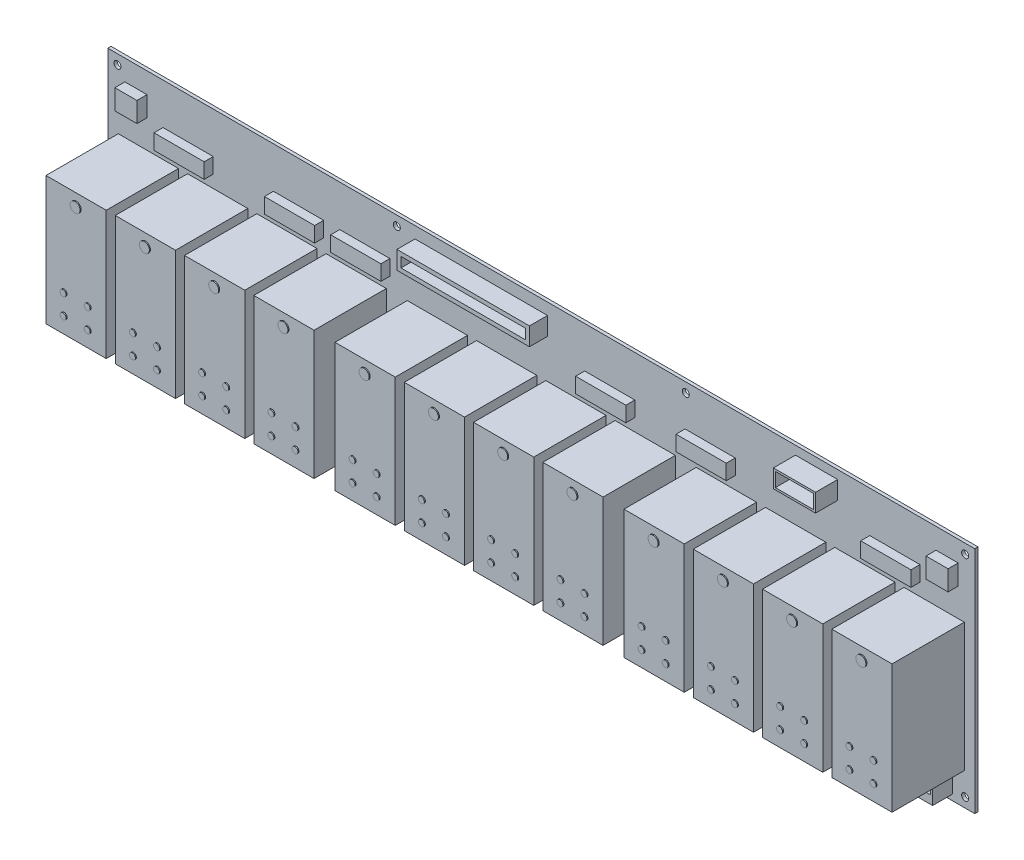
from build123d import *

# Parameters (mm, degrees)
SKETCH1_W    = 431.8
SKETCH1_H    = 114.3
PCB_DEPTH    = 1.6
SKETCH2_W    = 25
SKETCH2_H    = 7.6
BODY00_DEPTH = 4.5
SKETCH3_W    = 11
SKETCH3_H    = 10
BODY01_DEPTH = 5
SKETCH4_W    = 66
SKETCH4_H    = 9
BODY02_DEPTH = 9
SKETCH5_W    = 121.92
SKETCH5_H    = 9
BODY03_DEPTH = 10
SKETCH6_W    = 21
SKETCH6_H    = 9
BODY04_DEPTH = 11
SKETCH7_W    = 30
SKETCH7_H    = 64
BODY05_DEPTH = 36
SKETCH8_R    = 1.5
SKETCH8_R_2  = 2.5
BODY06_DEPTH = 0.5
SKETCH9_W    = 3.2
SKETCH9_H    = 3.2
CUT00_DEPTH  = 4
SKETCH10_W   = 62
SKETCH10_H   = 5
CUT01_DEPTH  = 7
SKETCH11_W   = 2.8
SKETCH11_H   = 2.8
CUT02_DEPTH  = 3
SKETCH12_W   = 19
SKETCH12_H   = 7
CUT03_DEPTH  = 8
SKETCH13_R   = 1.75
HOLES_DEPTH  = 1.6


with BuildPart() as part:
    # Sketch1 → PCB (new body)
    with BuildSketch(Plane.XY):
        with Locations((215.9, 57.15)):
            Rectangle(SKETCH1_W, SKETCH1_H)
    extrude(amount=PCB_DEPTH)

    # Sketch2 → Body00 (add)
    with BuildSketch(Plane.XY.offset(1.6)):
        with Locations((40, 90)):
            Rectangle(SKETCH2_W, SKETCH2_H)
        with Locations((95, 90)):
            Rectangle(SKETCH2_W, SKETCH2_H)
        with Locations((128, 90)):
            Rectangle(SKETCH2_W, SKETCH2_H)
        with Locations((250, 90)):
            Rectangle(SKETCH2_W, SKETCH2_H)
        with Locations((300, 90)):
            Rectangle(SKETCH2_W, SKETCH2_H)
        with Locations((392, 90)):
            Rectangle(SKETCH2_W, SKETCH2_H)
    extrude(amount=BODY00_DEPTH)

    # Sketch3 → Body01 (add)
    with BuildSketch(Plane.XY.offset(1.6)):
        with Locations((14, 99)):
            Rectangle(SKETCH3_W, SKETCH3_H)
        with Locations((418, 99)):
            Rectangle(SKETCH3_W, SKETCH3_H)
    extrude(amount=BODY01_DEPTH)

    # Sketch4 → Body02 (add)
    with BuildSketch(Plane.XY.offset(1.6)):
        with Locations((186, 104)):
            Rectangle(SKETCH4_W, SKETCH4_H)
    extrude(amount=BODY02_DEPTH)

    # Sketch5 → Body03 (add)
    with BuildSketch(Plane.XY.offset(1.6)):
        with Locations((71.967, 7.5)):
            Rectangle(SKETCH5_W, SKETCH5_H)
        with Locations((215.9, 7.5)):
            Rectangle(SKETCH5_W, SKETCH5_H)
        with Locations((359.833, 7.5)):
            Rectangle(SKETCH5_W, SKETCH5_H)
    extrude(amount=BODY03_DEPTH)

    # Sketch6 → Body04 (add)
    with BuildSketch(Plane.XY.offset(1.6)):
        with Locations((353, 105.5)):
            Rectangle(SKETCH6_W, SKETCH6_H)
    extrude(amount=BODY04_DEPTH)

    # Sketch7 → Body05 (add)
    with BuildSketch(Plane.XY.offset(1.6)):
        with Locations((20.217, 48)):
            Rectangle(SKETCH7_W, SKETCH7_H)
        with Locations((54.717, 48)):
            Rectangle(SKETCH7_W, SKETCH7_H)
        with Locations((89.217, 48)):
            Rectangle(SKETCH7_W, SKETCH7_H)
        with Locations((123.717, 48)):
            Rectangle(SKETCH7_W, SKETCH7_H)
        with Locations((164.15, 48)):
            Rectangle(SKETCH7_W, SKETCH7_H)
        with Locations((198.65, 48)):
            Rectangle(SKETCH7_W, SKETCH7_H)
        with Locations((233.15, 48)):
            Rectangle(SKETCH7_W, SKETCH7_H)
        with Locations((267.65, 48)):
            Rectangle(SKETCH7_W, SKETCH7_H)
        with Locations((308.083, 48)):
            Rectangle(SKETCH7_W, SKETCH7_H)
        with Locations((342.583, 48)):
            Rectangle(SKETCH7_W, SKETCH7_H)
        with Locations((377.083, 48)):
            Rectangle(SKETCH7_W, SKETCH7_H)
        with Locations((411.583, 48)):
            Rectangle(SKETCH7_W, SKETCH7_H)
    extrude(amount=BODY05_DEPTH)

    # Sketch8 → Body06 (add)
    with BuildSketch(Plane.XY.offset(37.6)):
        with Locations((14.217, 24)):
            Circle(SKETCH8_R)
        with Locations((14.217, 34)):
            Circle(SKETCH8_R)
        with Locations((26.217, 24)):
            Circle(SKETCH8_R)
        with Locations((26.217, 34)):
            Circle(SKETCH8_R)
        with Locations((20.217, 74)):
            Circle(SKETCH8_R_2)
        with Locations((48.717, 24)):
            Circle(SKETCH8_R)
        with Locations((48.717, 34)):
            Circle(SKETCH8_R)
        with Locations((60.717, 24)):
            Circle(SKETCH8_R)
        with Locations((60.717, 34)):
            Circle(SKETCH8_R)
        with Locations((54.717, 74)):
            Circle(SKETCH8_R_2)
        with Locations((83.217, 24)):
            Circle(SKETCH8_R)
        with Locations((83.217, 34)):
            Circle(SKETCH8_R)
        with Locations((95.217, 24)):
            Circle(SKETCH8_R)
        with Locations((95.217, 34)):
            Circle(SKETCH8_R)
        with Locations((89.217, 74)):
            Circle(SKETCH8_R_2)
        with Locations((117.717, 24)):
            Circle(SKETCH8_R)
        with Locations((117.717, 34)):
            Circle(SKETCH8_R)
        with Locations((129.717, 24)):
            Circle(SKETCH8_R)
        with Locations((129.717, 34)):
            Circle(SKETCH8_R)
        with Locations((123.717, 74)):
            Circle(SKETCH8_R_2)
        with Locations((158.15, 24)):
            Circle(SKETCH8_R)
        with Locations((158.15, 34)):
            Circle(SKETCH8_R)
        with Locations((170.15, 24)):
            Circle(SKETCH8_R)
        with Locations((170.15, 34)):
            Circle(SKETCH8_R)
        with Locations((164.15, 74)):
            Circle(SKETCH8_R_2)
        with Locations((192.65, 24)):
            Circle(SKETCH8_R)
        with Locations((192.65, 34)):
            Circle(SKETCH8_R)
        with Locations((204.65, 24)):
            Circle(SKETCH8_R)
        with Locations((204.65, 34)):
            Circle(SKETCH8_R)
        with Locations((198.65, 74)):
            Circle(SKETCH8_R_2)
        with Locations((227.15, 24)):
            Circle(SKETCH8_R)
        with Locations((227.15, 34)):
            Circle(SKETCH8_R)
        with Locations((239.15, 24)):
            Circle(SKETCH8_R)
        with Locations((239.15, 34)):
            Circle(SKETCH8_R)
        with Locations((233.15, 74)):
            Circle(SKETCH8_R_2)
        with Locations((261.65, 24)):
            Circle(SKETCH8_R)
        with Locations((261.65, 34)):
            Circle(SKETCH8_R)
        with Locations((273.65, 24)):
            Circle(SKETCH8_R)
        with Locations((273.65, 34)):
            Circle(SKETCH8_R)
        with Locations((267.65, 74)):
            Circle(SKETCH8_R_2)
        with Locations((302.083, 24)):
            Circle(SKETCH8_R)
        with Locations((302.083, 34)):
            Circle(SKETCH8_R)
        with Locations((314.083, 24)):
            Circle(SKETCH8_R)
        with Locations((314.083, 34)):
            Circle(SKETCH8_R)
        with Locations((308.083, 74)):
            Circle(SKETCH8_R_2)
        with Locations((336.583, 24)):
            Circle(SKETCH8_R)
        with Locations((336.583, 34)):
            Circle(SKETCH8_R)
        with Locations((348.583, 24)):
            Circle(SKETCH8_R)
        with Locations((348.583, 34)):
            Circle(SKETCH8_R)
        with Locations((342.583, 74)):
            Circle(SKETCH8_R_2)
        with Locations((371.083, 24)):
            Circle(SKETCH8_R)
        with Locations((371.083, 34)):
            Circle(SKETCH8_R)
        with Locations((383.083, 24)):
            Circle(SKETCH8_R)
        with Locations((383.083, 34)):
            Circle(SKETCH8_R)
        with Locations((377.083, 74)):
            Circle(SKETCH8_R_2)
        with Locations((405.583, 24)):
            Circle(SKETCH8_R)
        with Locations((405.583, 34)):
            Circle(SKETCH8_R)
        with Locations((417.583, 24)):
            Circle(SKETCH8_R)
        with Locations((417.583, 34)):
            Circle(SKETCH8_R)
        with Locations((411.583, 74)):
            Circle(SKETCH8_R_2)
    extrude(amount=BODY06_DEPTH)

    # Sketch9 → Cut00 (cut)
    with BuildSketch(Plane(origin=(0, 7, 0), x_dir=(1, 0, 0), z_dir=(0, 1, 0))):
        with Locations((13.547, -5.1)):
            Rectangle(SKETCH9_W, SKETCH9_H)
        with Locations((18.627, -5.1)):
            Rectangle(SKETCH9_W, SKETCH9_H)
        with Locations((23.707, -5.1)):
            Rectangle(SKETCH9_W, SKETCH9_H)
        with Locations((28.787, -5.1)):
            Rectangle(SKETCH9_W, SKETCH9_H)
        with Locations((33.867, -5.1)):
            Rectangle(SKETCH9_W, SKETCH9_H)
        with Locations((38.947, -5.1)):
            Rectangle(SKETCH9_W, SKETCH9_H)
        with Locations((44.027, -5.1)):
            Rectangle(SKETCH9_W, SKETCH9_H)
        with Locations((49.107, -5.1)):
            Rectangle(SKETCH9_W, SKETCH9_H)
        with Locations((54.187, -5.1)):
            Rectangle(SKETCH9_W, SKETCH9_H)
        with Locations((59.267, -5.1)):
            Rectangle(SKETCH9_W, SKETCH9_H)
        with Locations((64.347, -5.1)):
            Rectangle(SKETCH9_W, SKETCH9_H)
        with Locations((69.427, -5.1)):
            Rectangle(SKETCH9_W, SKETCH9_H)
        with Locations((74.507, -5.1)):
            Rectangle(SKETCH9_W, SKETCH9_H)
        with Locations((79.587, -5.1)):
            Rectangle(SKETCH9_W, SKETCH9_H)
        with Locations((84.667, -5.1)):
            Rectangle(SKETCH9_W, SKETCH9_H)
        with Locations((89.747, -5.1)):
            Rectangle(SKETCH9_W, SKETCH9_H)
        with Locations((94.827, -5.1)):
            Rectangle(SKETCH9_W, SKETCH9_H)
        with Locations((99.907, -5.1)):
            Rectangle(SKETCH9_W, SKETCH9_H)
        with Locations((104.987, -5.1)):
            Rectangle(SKETCH9_W, SKETCH9_H)
        with Locations((110.067, -5.1)):
            Rectangle(SKETCH9_W, SKETCH9_H)
        with Locations((115.147, -5.1)):
            Rectangle(SKETCH9_W, SKETCH9_H)
        with Locations((120.227, -5.1)):
            Rectangle(SKETCH9_W, SKETCH9_H)
        with Locations((125.307, -5.1)):
            Rectangle(SKETCH9_W, SKETCH9_H)
        with Locations((130.387, -5.1)):
            Rectangle(SKETCH9_W, SKETCH9_H)
        with Locations((157.48, -5.1)):
            Rectangle(SKETCH9_W, SKETCH9_H)
        with Locations((162.56, -5.1)):
            Rectangle(SKETCH9_W, SKETCH9_H)
        with Locations((167.64, -5.1)):
            Rectangle(SKETCH9_W, SKETCH9_H)
        with Locations((172.72, -5.1)):
            Rectangle(SKETCH9_W, SKETCH9_H)
        with Locations((177.8, -5.1)):
            Rectangle(SKETCH9_W, SKETCH9_H)
        with Locations((182.88, -5.1)):
            Rectangle(SKETCH9_W, SKETCH9_H)
        with Locations((187.96, -5.1)):
            Rectangle(SKETCH9_W, SKETCH9_H)
        with Locations((193.04, -5.1)):
            Rectangle(SKETCH9_W, SKETCH9_H)
        with Locations((198.12, -5.1)):
            Rectangle(SKETCH9_W, SKETCH9_H)
        with Locations((203.2, -5.1)):
            Rectangle(SKETCH9_W, SKETCH9_H)
        with Locations((208.28, -5.1)):
            Rectangle(SKETCH9_W, SKETCH9_H)
        with Locations((213.36, -5.1)):
            Rectangle(SKETCH9_W, SKETCH9_H)
        with Locations((218.44, -5.1)):
            Rectangle(SKETCH9_W, SKETCH9_H)
        with Locations((223.52, -5.1)):
            Rectangle(SKETCH9_W, SKETCH9_H)
        with Locations((228.6, -5.1)):
            Rectangle(SKETCH9_W, SKETCH9_H)
        with Locations((233.68, -5.1)):
            Rectangle(SKETCH9_W, SKETCH9_H)
        with Locations((238.76, -5.1)):
            Rectangle(SKETCH9_W, SKETCH9_H)
        with Locations((243.84, -5.1)):
            Rectangle(SKETCH9_W, SKETCH9_H)
        with Locations((248.92, -5.1)):
            Rectangle(SKETCH9_W, SKETCH9_H)
        with Locations((254, -5.1)):
            Rectangle(SKETCH9_W, SKETCH9_H)
        with Locations((259.08, -5.1)):
            Rectangle(SKETCH9_W, SKETCH9_H)
        with Locations((264.16, -5.1)):
            Rectangle(SKETCH9_W, SKETCH9_H)
        with Locations((269.24, -5.1)):
            Rectangle(SKETCH9_W, SKETCH9_H)
        with Locations((274.32, -5.1)):
            Rectangle(SKETCH9_W, SKETCH9_H)
        with Locations((301.413, -5.1)):
            Rectangle(SKETCH9_W, SKETCH9_H)
        with Locations((306.493, -5.1)):
            Rectangle(SKETCH9_W, SKETCH9_H)
        with Locations((311.573, -5.1)):
            Rectangle(SKETCH9_W, SKETCH9_H)
        with Locations((316.653, -5.1)):
            Rectangle(SKETCH9_W, SKETCH9_H)
        with Locations((321.733, -5.1)):
            Rectangle(SKETCH9_W, SKETCH9_H)
        with Locations((326.813, -5.1)):
            Rectangle(SKETCH9_W, SKETCH9_H)
        with Locations((331.893, -5.1)):
            Rectangle(SKETCH9_W, SKETCH9_H)
        with Locations((336.973, -5.1)):
            Rectangle(SKETCH9_W, SKETCH9_H)
        with Locations((342.053, -5.1)):
            Rectangle(SKETCH9_W, SKETCH9_H)
        with Locations((347.133, -5.1)):
            Rectangle(SKETCH9_W, SKETCH9_H)
        with Locations((352.213, -5.1)):
            Rectangle(SKETCH9_W, SKETCH9_H)
        with Locations((357.293, -5.1)):
            Rectangle(SKETCH9_W, SKETCH9_H)
        with Locations((362.373, -5.1)):
            Rectangle(SKETCH9_W, SKETCH9_H)
        with Locations((367.453, -5.1)):
            Rectangle(SKETCH9_W, SKETCH9_H)
        with Locations((372.533, -5.1)):
            Rectangle(SKETCH9_W, SKETCH9_H)
        with Locations((377.613, -5.1)):
            Rectangle(SKETCH9_W, SKETCH9_H)
        with Locations((382.693, -5.1)):
            Rectangle(SKETCH9_W, SKETCH9_H)
        with Locations((387.773, -5.1)):
            Rectangle(SKETCH9_W, SKETCH9_H)
        with Locations((392.853, -5.1)):
            Rectangle(SKETCH9_W, SKETCH9_H)
        with Locations((397.933, -5.1)):
            Rectangle(SKETCH9_W, SKETCH9_H)
        with Locations((403.013, -5.1)):
            Rectangle(SKETCH9_W, SKETCH9_H)
        with Locations((408.093, -5.1)):
            Rectangle(SKETCH9_W, SKETCH9_H)
        with Locations((413.173, -5.1)):
            Rectangle(SKETCH9_W, SKETCH9_H)
        with Locations((418.253, -5.1)):
            Rectangle(SKETCH9_W, SKETCH9_H)
    extrude(amount=-CUT00_DEPTH, mode=Mode.SUBTRACT)

    # Sketch10 → Cut01 (cut)
    with BuildSketch(Plane.XY.offset(10.6)):
        with Locations((186, 104)):
            Rectangle(SKETCH10_W, SKETCH10_H)
    extrude(amount=-CUT01_DEPTH, mode=Mode.SUBTRACT)

    # Sketch11 → Cut02 (cut)
    with BuildSketch(Plane.XY.offset(11.6)):
        with Locations((13.547, 8.5)):
            Rectangle(SKETCH11_W, SKETCH11_H)
        with Locations((18.627, 8.5)):
            Rectangle(SKETCH11_W, SKETCH11_H)
        with Locations((23.707, 8.5)):
            Rectangle(SKETCH11_W, SKETCH11_H)
        with Locations((28.787, 8.5)):
            Rectangle(SKETCH11_W, SKETCH11_H)
        with Locations((33.867, 8.5)):
            Rectangle(SKETCH11_W, SKETCH11_H)
        with Locations((38.947, 8.5)):
            Rectangle(SKETCH11_W, SKETCH11_H)
        with Locations((44.027, 8.5)):
            Rectangle(SKETCH11_W, SKETCH11_H)
        with Locations((49.107, 8.5)):
            Rectangle(SKETCH11_W, SKETCH11_H)
        with Locations((54.187, 8.5)):
            Rectangle(SKETCH11_W, SKETCH11_H)
        with Locations((59.267, 8.5)):
            Rectangle(SKETCH11_W, SKETCH11_H)
        with Locations((64.347, 8.5)):
            Rectangle(SKETCH11_W, SKETCH11_H)
        with Locations((69.427, 8.5)):
            Rectangle(SKETCH11_W, SKETCH11_H)
        with Locations((74.507, 8.5)):
            Rectangle(SKETCH11_W, SKETCH11_H)
        with Locations((79.587, 8.5)):
            Rectangle(SKETCH11_W, SKETCH11_H)
        with Locations((84.667, 8.5)):
            Rectangle(SKETCH11_W, SKETCH11_H)
        with Locations((89.747, 8.5)):
            Rectangle(SKETCH11_W, SKETCH11_H)
        with Locations((94.827, 8.5)):
            Rectangle(SKETCH11_W, SKETCH11_H)
        with Locations((99.907, 8.5)):
            Rectangle(SKETCH11_W, SKETCH11_H)
        with Locations((104.987, 8.5)):
            Rectangle(SKETCH11_W, SKETCH11_H)
        with Locations((110.067, 8.5)):
            Rectangle(SKETCH11_W, SKETCH11_H)
        with Locations((115.147, 8.5)):
            Rectangle(SKETCH11_W, SKETCH11_H)
        with Locations((120.227, 8.5)):
            Rectangle(SKETCH11_W, SKETCH11_H)
        with Locations((125.307, 8.5)):
            Rectangle(SKETCH11_W, SKETCH11_H)
        with Locations((130.387, 8.5)):
            Rectangle(SKETCH11_W, SKETCH11_H)
        with Locations((157.48, 8.5)):
            Rectangle(SKETCH11_W, SKETCH11_H)
        with Locations((162.56, 8.5)):
            Rectangle(SKETCH11_W, SKETCH11_H)
        with Locations((167.64, 8.5)):
            Rectangle(SKETCH11_W, SKETCH11_H)
        with Locations((172.72, 8.5)):
            Rectangle(SKETCH11_W, SKETCH11_H)
        with Locations((177.8, 8.5)):
            Rectangle(SKETCH11_W, SKETCH11_H)
        with Locations((182.88, 8.5)):
            Rectangle(SKETCH11_W, SKETCH11_H)
        with Locations((187.96, 8.5)):
            Rectangle(SKETCH11_W, SKETCH11_H)
        with Locations((193.04, 8.5)):
            Rectangle(SKETCH11_W, SKETCH11_H)
        with Locations((198.12, 8.5)):
            Rectangle(SKETCH11_W, SKETCH11_H)
        with Locations((203.2, 8.5)):
            Rectangle(SKETCH11_W, SKETCH11_H)
        with Locations((208.28, 8.5)):
            Rectangle(SKETCH11_W, SKETCH11_H)
        with Locations((213.36, 8.5)):
            Rectangle(SKETCH11_W, SKETCH11_H)
        with Locations((218.44, 8.5)):
            Rectangle(SKETCH11_W, SKETCH11_H)
        with Locations((223.52, 8.5)):
            Rectangle(SKETCH11_W, SKETCH11_H)
        with Locations((228.6, 8.5)):
            Rectangle(SKETCH11_W, SKETCH11_H)
        with Locations((233.68, 8.5)):
            Rectangle(SKETCH11_W, SKETCH11_H)
        with Locations((238.76, 8.5)):
            Rectangle(SKETCH11_W, SKETCH11_H)
        with Locations((243.84, 8.5)):
            Rectangle(SKETCH11_W, SKETCH11_H)
        with Locations((248.92, 8.5)):
            Rectangle(SKETCH11_W, SKETCH11_H)
        with Locations((254, 8.5)):
            Rectangle(SKETCH11_W, SKETCH11_H)
        with Locations((259.08, 8.5)):
            Rectangle(SKETCH11_W, SKETCH11_H)
        with Locations((264.16, 8.5)):
            Rectangle(SKETCH11_W, SKETCH11_H)
        with Locations((269.24, 8.5)):
            Rectangle(SKETCH11_W, SKETCH11_H)
        with Locations((274.32, 8.5)):
            Rectangle(SKETCH11_W, SKETCH11_H)
        with Locations((301.413, 8.5)):
            Rectangle(SKETCH11_W, SKETCH11_H)
        with Locations((306.493, 8.5)):
            Rectangle(SKETCH11_W, SKETCH11_H)
        with Locations((311.573, 8.5)):
            Rectangle(SKETCH11_W, SKETCH11_H)
        with Locations((316.653, 8.5)):
            Rectangle(SKETCH11_W, SKETCH11_H)
        with Locations((321.733, 8.5)):
            Rectangle(SKETCH11_W, SKETCH11_H)
        with Locations((326.813, 8.5)):
            Rectangle(SKETCH11_W, SKETCH11_H)
        with Locations((331.893, 8.5)):
            Rectangle(SKETCH11_W, SKETCH11_H)
        with Locations((336.973, 8.5)):
            Rectangle(SKETCH11_W, SKETCH11_H)
        with Locations((342.053, 8.5)):
            Rectangle(SKETCH11_W, SKETCH11_H)
        with Locations((347.133, 8.5)):
            Rectangle(SKETCH11_W, SKETCH11_H)
        with Locations((352.213, 8.5)):
            Rectangle(SKETCH11_W, SKETCH11_H)
        with Locations((357.293, 8.5)):
            Rectangle(SKETCH11_W, SKETCH11_H)
        with Locations((362.373, 8.5)):
            Rectangle(SKETCH11_W, SKETCH11_H)
        with Locations((367.453, 8.5)):
            Rectangle(SKETCH11_W, SKETCH11_H)
        with Locations((372.533, 8.5)):
            Rectangle(SKETCH11_W, SKETCH11_H)
        with Locations((377.613, 8.5)):
            Rectangle(SKETCH11_W, SKETCH11_H)
        with Locations((382.693, 8.5)):
            Rectangle(SKETCH11_W, SKETCH11_H)
        with Locations((387.773, 8.5)):
            Rectangle(SKETCH11_W, SKETCH11_H)
        with Locations((392.853, 8.5)):
            Rectangle(SKETCH11_W, SKETCH11_H)
        with Locations((397.933, 8.5)):
            Rectangle(SKETCH11_W, SKETCH11_H)
        with Locations((403.013, 8.5)):
            Rectangle(SKETCH11_W, SKETCH11_H)
        with Locations((408.093, 8.5)):
            Rectangle(SKETCH11_W, SKETCH11_H)
        with Locations((413.173, 8.5)):
            Rectangle(SKETCH11_W, SKETCH11_H)
        with Locations((418.253, 8.5)):
            Rectangle(SKETCH11_W, SKETCH11_H)
    extrude(amount=-CUT02_DEPTH, mode=Mode.SUBTRACT)

    # Sketch12 → Cut03 (cut)
    with BuildSketch(Plane.XY.offset(12.6)):
        with Locations((353, 105.5)):
            Rectangle(SKETCH12_W, SKETCH12_H)
    extrude(amount=-CUT03_DEPTH, mode=Mode.SUBTRACT)

    # Sketch13 → Holes (cut)
    with BuildSketch(Plane.XY.offset(1.6)):
        with Locations((4.8, 4.8)):
            Circle(SKETCH13_R)
        with Locations((4.8, 109.5)):
            Circle(SKETCH13_R)
        with Locations((143.933, 4.8)):
            Circle(SKETCH13_R)
        with Locations((143.933, 109.5)):
            Circle(SKETCH13_R)
        with Locations((287.867, 4.8)):
            Circle(SKETCH13_R)
        with Locations((287.867, 109.5)):
            Circle(SKETCH13_R)
        with Locations((427, 4.8)):
            Circle(SKETCH13_R)
        with Locations((427, 109.5)):
            Circle(SKETCH13_R)
    extrude(amount=-HOLES_DEPTH, mode=Mode.SUBTRACT)


solid = part.part
